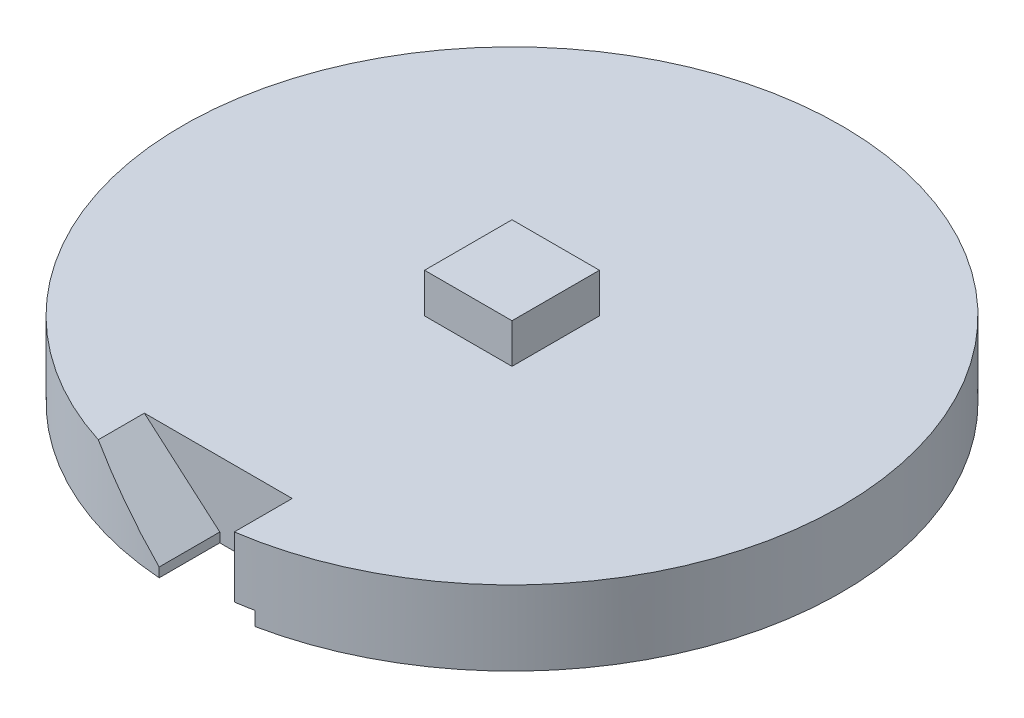
from build123d import *

# Parameters (mm, degrees)
SKETCH1_R           = 37.5
BOSS_EXTRUDE1_DEPTH = 8.5
SKETCH9_W           = 9.95
SKETCH9_H           = 9.95
BOSS_EXTRUDE2_DEPTH = 13
SKETCH2_R           = 5
BOSS_EXTRUDE3_DEPTH = 10
SKETCH11_W          = 5
SKETCH11_H          = 3
CUT_EXTRUDE5_DEPTH  = 10
CUT_EXTRUDE9_DEPTH  = 7


with BuildPart() as part:
    # Sketch1 → Boss-Extrude1 (new body)
    with BuildSketch(Plane(origin=(0, 0, 0), x_dir=(1, 0, 0), z_dir=(0, 1, 0))):
        Circle(SKETCH1_R)
    extrude(amount=BOSS_EXTRUDE1_DEPTH)

    # Sketch9 → Boss-Extrude2 (add)
    with BuildSketch(Plane(origin=(0, 0, 0), x_dir=(1, 0, 0), z_dir=(0, 1, 0))):
        Rectangle(SKETCH9_W, SKETCH9_H)
    extrude(amount=BOSS_EXTRUDE2_DEPTH)

    # Sketch2 → Boss-Extrude3 (add)
    with BuildSketch(Plane.XZ):
        Circle(SKETCH2_R)
    extrude(amount=BOSS_EXTRUDE3_DEPTH)

    # Sketch11 → Cut-Extrude5 (cut)
    with BuildSketch(Plane.XZ.offset(10)):
        with Locations((0.097841348, 0.171762021)):
            Rectangle(SKETCH11_W, SKETCH11_H)
    extrude(amount=-CUT_EXTRUDE5_DEPTH, mode=Mode.SUBTRACT)

    # Sketch14 → Cut-Extrude9 (cut)
    with BuildSketch(Plane.XY.offset(37.5)):
        Polygon((-1.479409771, -0.034279728), (5.487832291, -0.034279728), (7.493094394, 0), (7.493094394, 1.595594951), (5.487832291, 1.595594951), (5.487832291, 5.965720272), (5.487832291, 8.5), (-11.335299807, 8.5), (-2.75755208, 1.072472069), (-2.75755208, 0), align=None)
    extrude(amount=-CUT_EXTRUDE9_DEPTH, mode=Mode.SUBTRACT)


solid = part.part
